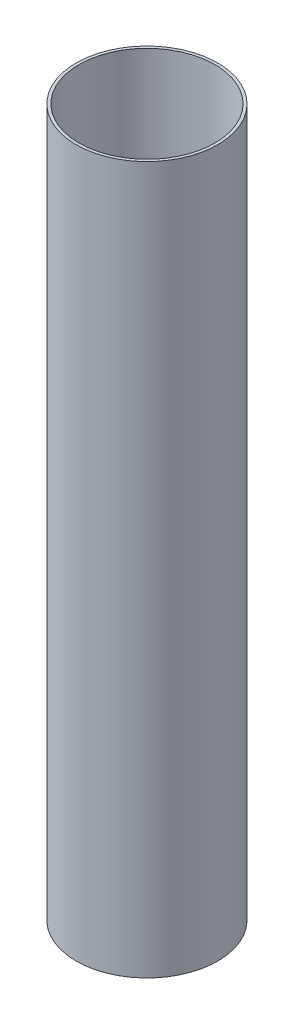
from build123d import *

# Parameters (mm, degrees)
SKETCH1_R           = 39.6748
SKETCH1_R_2         = 38.1
BOSS_EXTRUDE1_DEPTH = 198.12


with BuildPart() as part:
    # Sketch1 → Boss-Extrude1 (new, symmetric)
    with BuildSketch(Plane(origin=(0, 0, 0), x_dir=(1, 0, 0), z_dir=(0, 1, 0))):
        Circle(SKETCH1_R)
        Circle(SKETCH1_R_2, mode=Mode.SUBTRACT)
    extrude(amount=BOSS_EXTRUDE1_DEPTH, both=True)


solid = part.part
